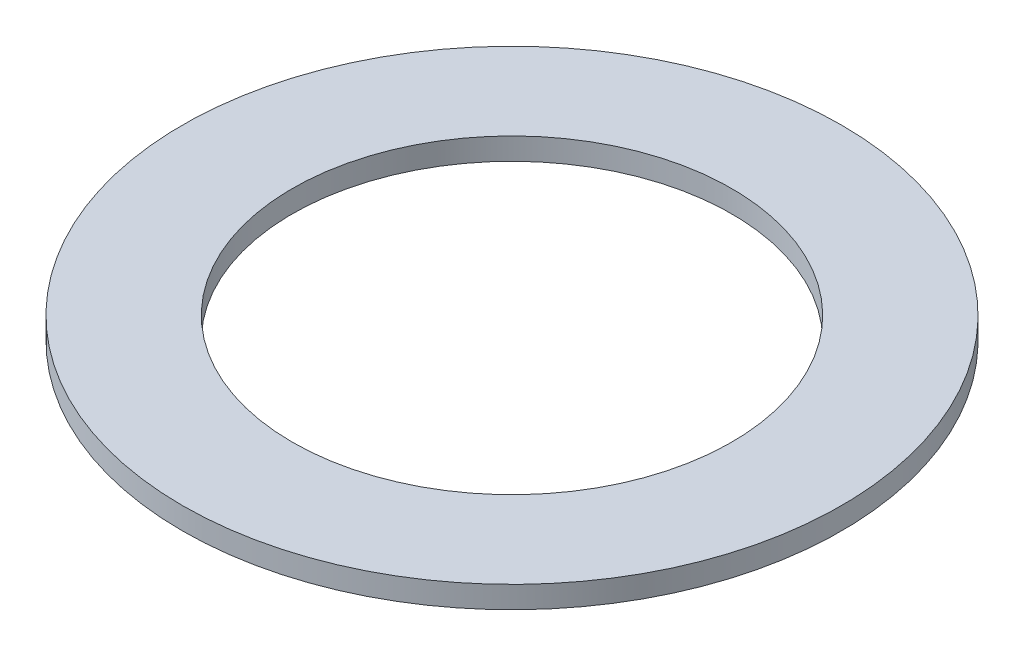
from build123d import *

# Parameters (mm, degrees)
SKETCH1_R           = 75
BOSS_EXTRUDE1_DEPTH = 5
SKETCH2_R           = 50
CUT_EXTRUDE1_DEPTH  = 107.183802908


with BuildPart() as part:
    # Sketch1 → Boss-Extrude1 (new body)
    with BuildSketch(Plane(origin=(0, 0, 0), x_dir=(1, 0, 0), z_dir=(0, 1, 0))):
        Circle(SKETCH1_R)
    extrude(amount=BOSS_EXTRUDE1_DEPTH)

    # Sketch2 → Cut-Extrude1 (cut, through all)
    with BuildSketch(Plane(origin=(0, 0, 0), x_dir=(1, 0, 0), z_dir=(0, 1, 0))):
        Circle(SKETCH2_R)
    extrude(amount=CUT_EXTRUDE1_DEPTH, mode=Mode.SUBTRACT)


solid = part.part
